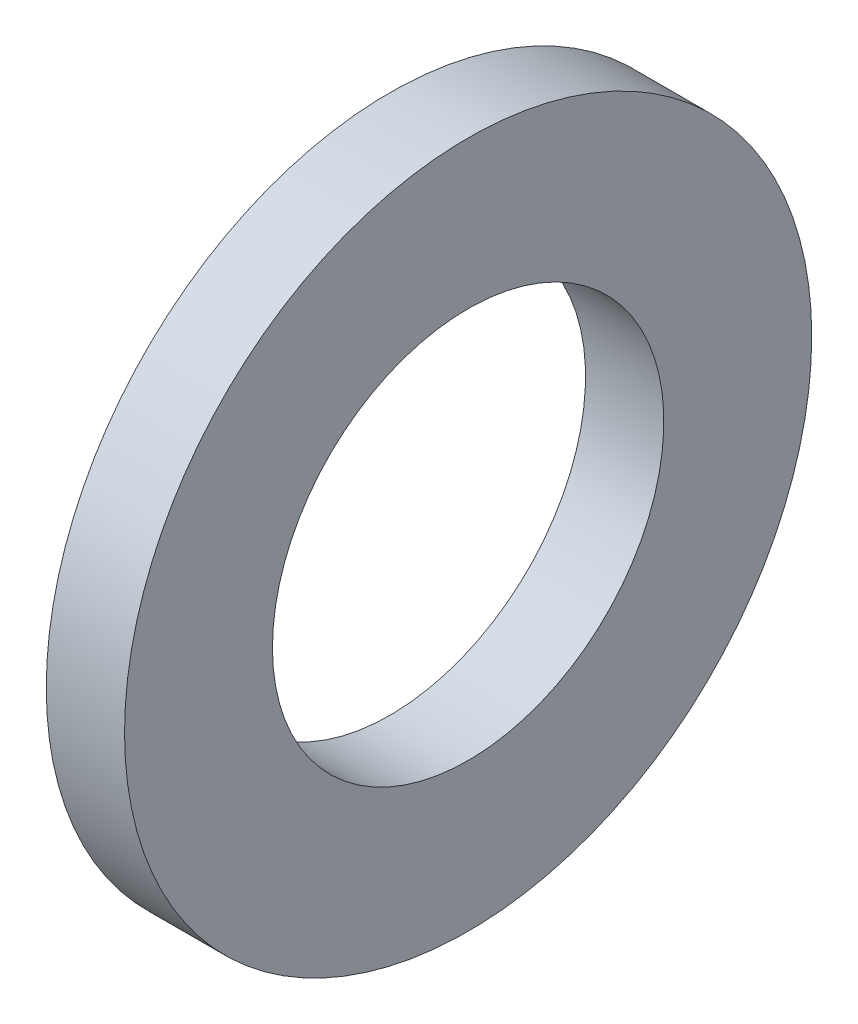
from build123d import *

# Parameters (mm, degrees)
SKETCH3_W = 3.175
SKETCH3_H = 5.99899994


with BuildPart() as part:
    # Sketch3 → Revolve1 (revolve)
    with BuildSketch(Plane.XY):
        with Locations((3.421899684, 10.93699997)):
            Rectangle(SKETCH3_W, SKETCH3_H)
    revolve(axis=Axis((0, 0, 0), (1, 0, 0)))


solid = part.part
